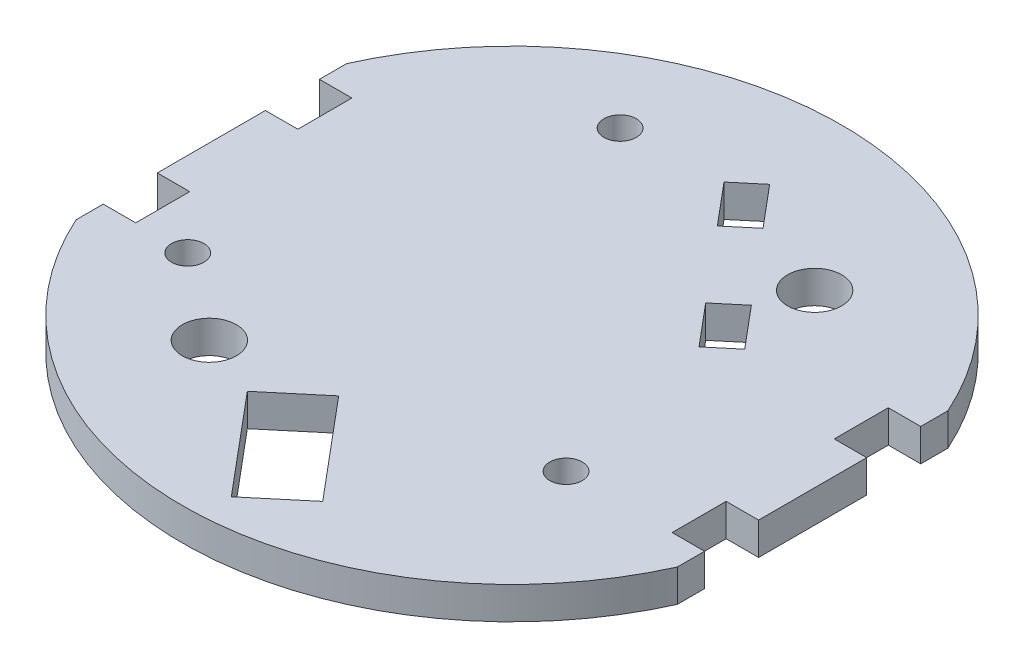
from build123d import *

# Parameters (mm, degrees)
CROQUIS1_R              = 30.5
SALIENTE_EXTRUIR1_DEPTH = 3
CORTAR_EXTRUIR3_START   = -4
CORTAR_EXTRUIR3_DEPTH   = 4
CORTAR_EXTRUIR5_DEPTH   = 4
CROQUIS8_R              = 2.5
CORTAR_EXTRUIR6_DEPTH   = 10
CROQUIS9_R              = 1.5
CORTAR_EXTRUIR7_DEPTH   = 3
CORTAR_EXTRUIR8_START   = -3
CORTAR_EXTRUIR8_DEPTH   = 3


with BuildPart() as part:
    # Croquis1 → Saliente-Extruir1 (new body)
    with BuildSketch(Plane(origin=(0, 0, 0), x_dir=(1, 0, 0), z_dir=(0, 1, 0))):
        Circle(CROQUIS1_R)
    extrude(amount=SALIENTE_EXTRUIR1_DEPTH)

    # Croquis5 → Cortar-Extruir3 (cut)
    with BuildSketch(Plane(origin=(0, 3, 0), x_dir=(1, 0, 0), z_dir=(0, 1, 0)).offset(CORTAR_EXTRUIR3_START)):
        with BuildLine():
            Line((30.087372767, -5), (24.814059068, -5))
            Line((24.814059068, -5), (24.814059068, -10))
            Line((24.814059068, -10), (28.814059068, -10))
            ThreePointArc((28.814059068, -10), (29.556634924, -7.526973624), (30.087372767, -5))
        make_face()
        with BuildLine():
            Line((24.814059068, 5), (30.087372767, 5))
            ThreePointArc((30.087372767, 5), (29.556634924, 7.526973624), (28.814059068, 10))
            Line((28.814059068, 10), (24.814059068, 10))
            Line((24.814059068, 10), (24.814059068, 5))
        make_face()
        with BuildLine():
            ThreePointArc((-30.087372767, -5), (-29.556634924, -7.526973624), (-28.814059068, -10))
            Line((-28.814059068, -10), (-24.814059068, -10))
            Line((-24.814059068, -10), (-24.814059068, -5))
            Line((-24.814059068, -5), (-30.087372767, -5))
        make_face()
        with BuildLine():
            Line((-24.814059068, 10), (-28.814059068, 10))
            ThreePointArc((-28.814059068, 10), (-29.556634924, 7.526973624), (-30.087372767, 5))
            Line((-30.087372767, 5), (-24.814059068, 5))
            Line((-24.814059068, 5), (-24.814059068, 10))
        make_face()
    extrude(amount=CORTAR_EXTRUIR3_DEPTH, mode=Mode.SUBTRACT)

    # Croquis7 → Cortar-Extruir5 (cut)
    with BuildSketch(Plane(origin=(0, 3, 0), x_dir=(1, 0, 0), z_dir=(0, 1, 0))):
        Polygon((1.428390211, 22.411430151), (-0.869743118, 20.483067322), (2.34419493, 16.652845106), (4.642328259, 18.581207935), align=None)
        Polygon((10.266719844, 11.878319058), (7.968586515, 9.949956229), (11.182524563, 6.119734013), (13.480657893, 8.048096842), align=None)
    extrude(amount=-CORTAR_EXTRUIR5_DEPTH, mode=Mode.SUBTRACT)

    # Croquis8 → Cortar-Extruir6 (cut)
    with BuildSketch(Plane(origin=(0, 3, 0), x_dir=(1, 0, 0), z_dir=(0, 1, 0))):
        with Locations((12, 16)):
            Circle(CROQUIS8_R)
        with Locations((-12, -16)):
            Circle(CROQUIS8_R)
        Polygon((-1.558592329, -14.475370512), (-6.154858987, -18.33209617), (1.558592329, -27.524629488), (6.154858987, -23.66790383), align=None)
    extrude(amount=-CORTAR_EXTRUIR6_DEPTH, mode=Mode.SUBTRACT)

    # Croquis9 → Cortar-Extruir7 (cut)
    with BuildSketch(Plane(origin=(0, 3, 0), x_dir=(1, 0, 0), z_dir=(0, 1, 0))):
        with Locations((-10, 20)):
            Circle(CROQUIS9_R)
        with Locations((-20, -10)):
            Circle(CROQUIS9_R)
        with Locations((15, -10)):
            Circle(CROQUIS9_R)
    extrude(amount=-CORTAR_EXTRUIR7_DEPTH, mode=Mode.SUBTRACT)

    # Croquis10 → Cortar-Extruir8 (cut)
    with BuildSketch(Plane(origin=(0, 3, 0), x_dir=(1, 0, 0), z_dir=(0, 1, 0)).offset(CORTAR_EXTRUIR8_START)):
        with BuildLine():
            Line((-28.814059068, 10), (-27.814059068, 10))
            Line((-27.814059068, 10), (-27.814059068, 12.515115586))
            ThreePointArc((-27.814059068, 12.515115586), (-28.341972277, 11.268655974), (-28.814059068, 10))
        make_face()
        with BuildLine():
            ThreePointArc((28.814059069, 10), (28.341972277, 11.268655974), (27.814059069, 12.515115586))
            Line((27.814059069, 12.515115586), (27.814059069, 10))
            Line((27.814059069, 10), (28.814059069, 10))
        make_face()
        with BuildLine():
            Line((-27.814059068, -5), (-27.814059068, 5))
            Line((-27.814059068, 5), (-30.087372767, 5))
            ThreePointArc((-30.087372767, 5), (-30.5, 0), (-30.087372767, -5))
            Line((-30.087372767, -5), (-27.814059068, -5))
        make_face()
        with BuildLine():
            Line((-27.814059068, -12.515115586), (-27.814059068, -10))
            Line((-27.814059068, -10), (-28.814059068, -10))
            ThreePointArc((-28.814059068, -10), (-28.341972277, -11.268655974), (-27.814059068, -12.515115586))
        make_face()
        with BuildLine():
            Line((27.814059069, -10), (27.814059069, -12.515115586))
            ThreePointArc((27.814059069, -12.515115586), (28.341972277, -11.268655974), (28.814059068, -10))
            Line((28.814059068, -10), (27.814059069, -10))
        make_face()
        with BuildLine():
            Line((30.087372767, 5), (27.814059069, 5))
            Line((27.814059069, 5), (27.814059069, -5))
            Line((27.814059069, -5), (30.087372767, -5))
            ThreePointArc((30.087372767, -5), (30.5, 0), (30.087372767, 5))
        make_face()
    extrude(amount=CORTAR_EXTRUIR8_DEPTH, mode=Mode.SUBTRACT)


solid = part.part
